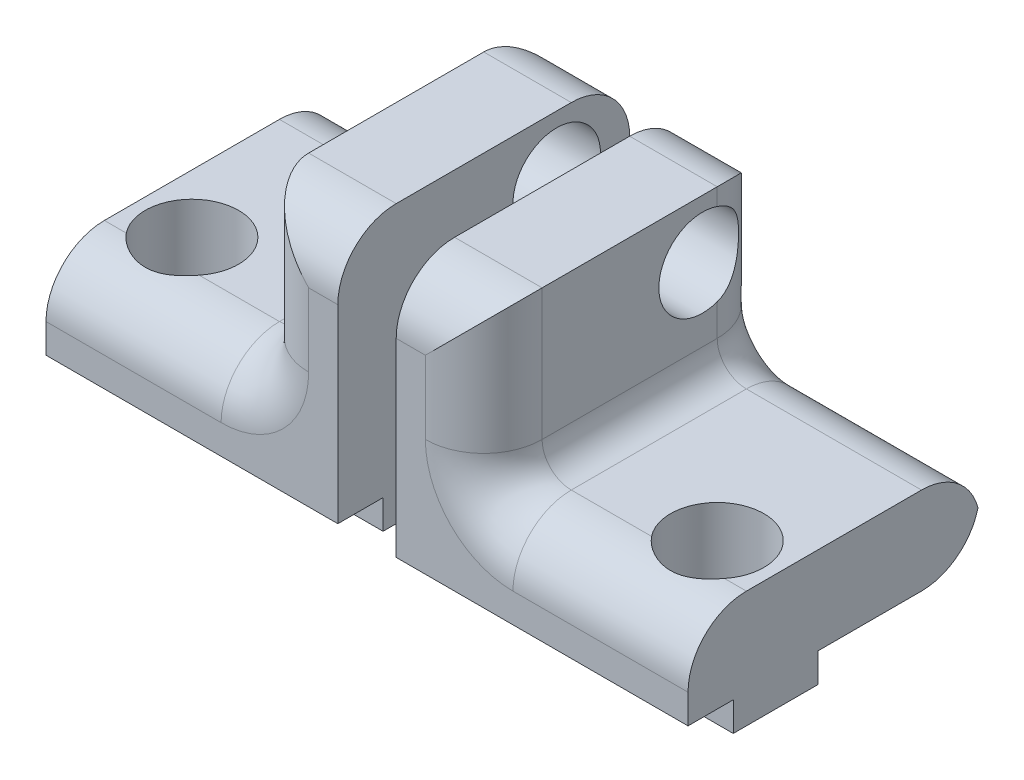
from build123d import *

# Parameters (mm, degrees)
MAIN_DEPTH               = 5
VERTICALHOLE_DEPTH       = 15.044571905
VERTICALHOLE_DEPTH_BACK  = 15.044571905
ESQUISSE2_R              = 1.5
ESQUISSE5_W              = 10
ESQUISSE5_H              = 2.9
MAKERBEAMSUPPORT_DEPTH   = 1
MAKERBEAMHOLE_DEPTH      = 15.044571905
MAKERBEAMHOLE_DEPTH_BACK = 15.044571905
ESQUISSE3_R              = 1.6
FILLET1_R                = 2


with BuildPart() as part:
    # Esquisse1 → Main (new, symmetric)
    with BuildSketch(Plane.XY):
        with BuildLine():
            Line((0, 0), (10, 0))
            Line((10, 0), (10, 3))
            Line((10, 3), (4, 3))
            ThreePointArc((4, 3), (3.292893219, 3.292893219), (3, 4))
            Line((3, 4), (3, 8.5))
            Line((3, 8.5), (0, 8.5))
            Line((0, 8.5), (0, 0))
        make_face()
    extrude(amount=MAIN_DEPTH, both=True)

    # Esquisse2 → VerticalHole (cut, two sides: drawn at the far end of the back side and taken through both)
    with BuildSketch(Plane.ZY.offset(-VERTICALHOLE_DEPTH_BACK)):
        with Locations((-2.5, 6.5)):
            Circle(ESQUISSE2_R)
    extrude(amount=VERTICALHOLE_DEPTH + VERTICALHOLE_DEPTH_BACK, mode=Mode.SUBTRACT)

    # Esquisse5 → MakerBeamSupport (add)
    with BuildSketch(Plane(origin=(0, 0, 0), x_dir=(-1, 0, 0), z_dir=(0, -1, 0))):
        with Locations((-5, -2)):
            Rectangle(ESQUISSE5_W, ESQUISSE5_H)
    extrude(amount=MAKERBEAMSUPPORT_DEPTH)

    # Esquisse3 → MakerBeamHole (cut, two sides: drawn at the far end of the back side and taken through both)
    with BuildSketch(Plane.XZ.offset(-MAKERBEAMHOLE_DEPTH_BACK)):
        with Locations(Location((8, 2, 0), (0, 0, 295.007833235))):
            Circle(ESQUISSE3_R)
    extrude(amount=MAKERBEAMHOLE_DEPTH + MAKERBEAMHOLE_DEPTH_BACK, mode=Mode.SUBTRACT)

    # Fillet1
    # the kernel refuses this fillet: 2 mm, written as the material it takes off along each edge
    with BuildSketch(Plane(origin=(3, 4, -5), x_dir=(-1, 0, 0), z_dir=(0, 1, 0))) as fillet1_piece_1:
        with BuildLine():
            CenterArc((FILLET1_R, FILLET1_R), FILLET1_R, 180, 90)
            Line((0, FILLET1_R), (0, 0))
            Line((0, 0), (FILLET1_R, 0))
        make_face()
    extrude(amount=9.5, mode=Mode.SUBTRACT)
    with BuildSketch(Plane(origin=(4, 4, -5), x_dir=(0, -1, 0), z_dir=(1, 0, 0))) as fillet1_piece_2:
        with BuildLine():
            CenterArc((1 + FILLET1_R, -FILLET1_R), FILLET1_R, 90, 90)
            Line((1, -FILLET1_R), (1, 0))
            Line((1, 0), (1 + FILLET1_R, 0))
        make_face()
    revolve(axis=Axis((4, 4, -5), (0, 0, -1)), revolution_arc=90, mode=Mode.SUBTRACT)
    with BuildSketch(Plane(origin=(3, 4, 5), x_dir=(-1, 0, 0), z_dir=(0, 1, 0))) as fillet1_piece_3:
        with BuildLine():
            CenterArc((FILLET1_R, -FILLET1_R), FILLET1_R, 90, 90)
            Line((0, -FILLET1_R), (0, 0))
            Line((0, 0), (FILLET1_R, 0))
        make_face()
    extrude(amount=9.5, mode=Mode.SUBTRACT)
    with BuildSketch(Plane(origin=(4, 4, 5), x_dir=(0, -1, 0), z_dir=(1, 0, 0))) as fillet1_piece_4:
        with BuildLine():
            CenterArc((1 + FILLET1_R, FILLET1_R), FILLET1_R, 180, 90)
            Line((1, FILLET1_R), (1, 0))
            Line((1, 0), (1 + FILLET1_R, 0))
        make_face()
    revolve(axis=Axis((4, 4, 5), (0, 0, -1)), revolution_arc=90, mode=Mode.SUBTRACT)
    with BuildSketch(Plane(origin=(15, 3, -5), x_dir=(0, -1, 0), z_dir=(-1, 0, 0)), Plane(origin=(15, 3, 5), x_dir=(0, 0, -1), z_dir=(-1, 0, 0))) as fillet1_piece_5:
        with BuildLine():
            CenterArc((FILLET1_R, FILLET1_R), FILLET1_R, 180, 90)
            Line((0, FILLET1_R), (0, 0))
            Line((0, 0), (FILLET1_R, 0))
        make_face()
    extrude(amount=11, mode=Mode.SUBTRACT)
    with BuildSketch(Plane(origin=(8, 8.5, -5), x_dir=(0, -1, 0), z_dir=(-1, 0, 0))) as fillet1_piece_6:
        with BuildLine():
            CenterArc((FILLET1_R, FILLET1_R), FILLET1_R, 180, 90)
            Line((0, FILLET1_R), (0, 0))
            Line((0, 0), (FILLET1_R, 0))
        make_face()
    extrude(amount=13, mode=Mode.SUBTRACT)
    with BuildSketch(Plane(origin=(8, 8.5, 5), x_dir=(0, -1, 0), z_dir=(-1, 0, 0))) as fillet1_piece_7:
        with BuildLine():
            CenterArc((FILLET1_R, -FILLET1_R), FILLET1_R, 90, 90)
            Line((0, -FILLET1_R), (0, 0))
            Line((0, 0), (FILLET1_R, 0))
        make_face()
    extrude(amount=13, mode=Mode.SUBTRACT)
    with BuildSketch(Plane(origin=(-5, 0, -5), x_dir=(0, 0, 1), z_dir=(1, 0, 0))) as fillet1_piece_8:
        with BuildLine():
            CenterArc((FILLET1_R, -FILLET1_R), FILLET1_R, 90, 90)
            Line((0, -FILLET1_R), (0, 0))
            Line((0, 0), (FILLET1_R, 0))
        make_face()
    extrude(amount=20, mode=Mode.SUBTRACT)


with BuildPart() as body_2:
    # Mirror2: mirrored copy
    add(part.part.mirror(Plane.ZY.offset(1)))


solid = Compound([part.part, body_2.part])
